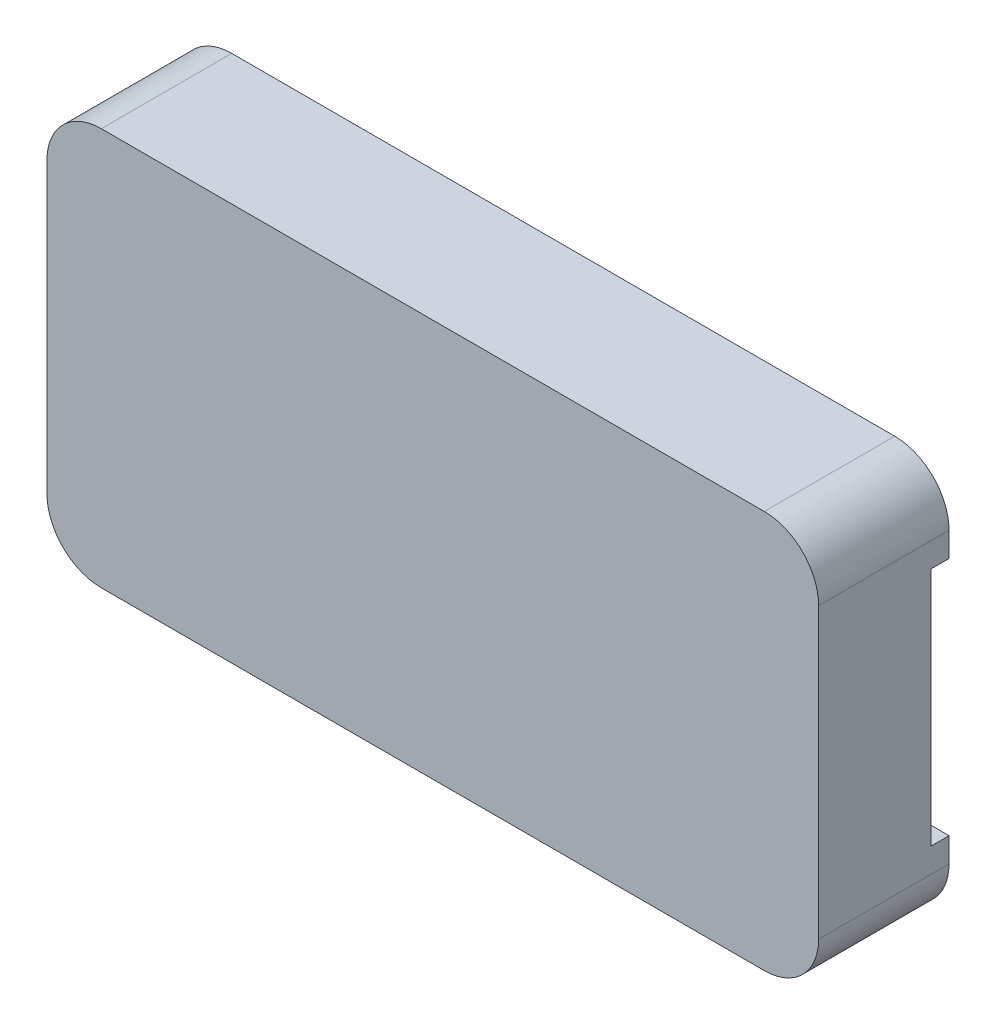
from build123d import *

# Parameters (mm, degrees)
SKETCH2_W           = 42.6
SKETCH2_H           = 21.95
BOSS_EXTRUDE1_DEPTH = 7.2
FILLET1_R           = 3
SKETCH3_W           = 4.07
SKETCH3_H           = 13.25
CUT_EXTRUDE1_DEPTH  = 5.2
BOSS_EXTRUDE2_DEPTH = 5.2
BOSS_EXTRUDE3_DEPTH = 4.2


with BuildPart() as part:
    # Sketch2 → Boss-Extrude1 (new body)
    with BuildSketch(Plane.XY):
        Rectangle(SKETCH2_W, SKETCH2_H)
    extrude(amount=BOSS_EXTRUDE1_DEPTH)

    # Fillet1
    fillet1_edges = [part.edges().sort_by_distance(p)[0] for p in [
        (-21.3, -10.975, 3.6),
        (21.3, -10.975, 3.6),
        (21.3, 10.975, 3.6),
        (-21.3, 10.975, 3.6),
    ]]
    fillet(fillet1_edges, radius=FILLET1_R)

    # Sketch3 → Cut-Extrude1 (cut)
    with BuildSketch(Plane(origin=(0, 0, 0), x_dir=(-1, 0, 0), z_dir=(0, 0, -1))):
        with Locations((-19.265, 0)):
            Rectangle(SKETCH3_W, SKETCH3_H)
    extrude(amount=-CUT_EXTRUDE1_DEPTH, mode=Mode.SUBTRACT)

    # Sketch4 → Boss-Extrude2 (add)
    with BuildSketch(Plane(origin=(0, 0, 5.2), x_dir=(-1, 0, 0), z_dir=(0, 0, -1))):
        Polygon((-20.15, 4.925), (-20.15, -4.925), (-18.4, -4.925), (-18.4, -3.815), (-19.11, -3.815), (-19.11, -0.555), (-18.4, -0.555), (-18.4, 0.555), (-19.11, 0.555), (-19.11, 3.815), (-18.4, 3.815), (-18.4, 4.925), align=None)
    extrude(amount=BOSS_EXTRUDE2_DEPTH)

    # Sketch5 → Boss-Extrude3 (add)
    with BuildSketch(Plane(origin=(0, 0, 5.2), x_dir=(-1, 0, 0), z_dir=(0, 0, -1))):
        Polygon((-21.3, 6.625), (-21.3, -6.625), (-19.9, -6.625), (-19.9, -4.925), (-20.15, -4.925), (-20.15, 4.925), (-19.9, 4.925), (-19.9, 6.625), align=None)
    extrude(amount=BOSS_EXTRUDE3_DEPTH)


solid = part.part
